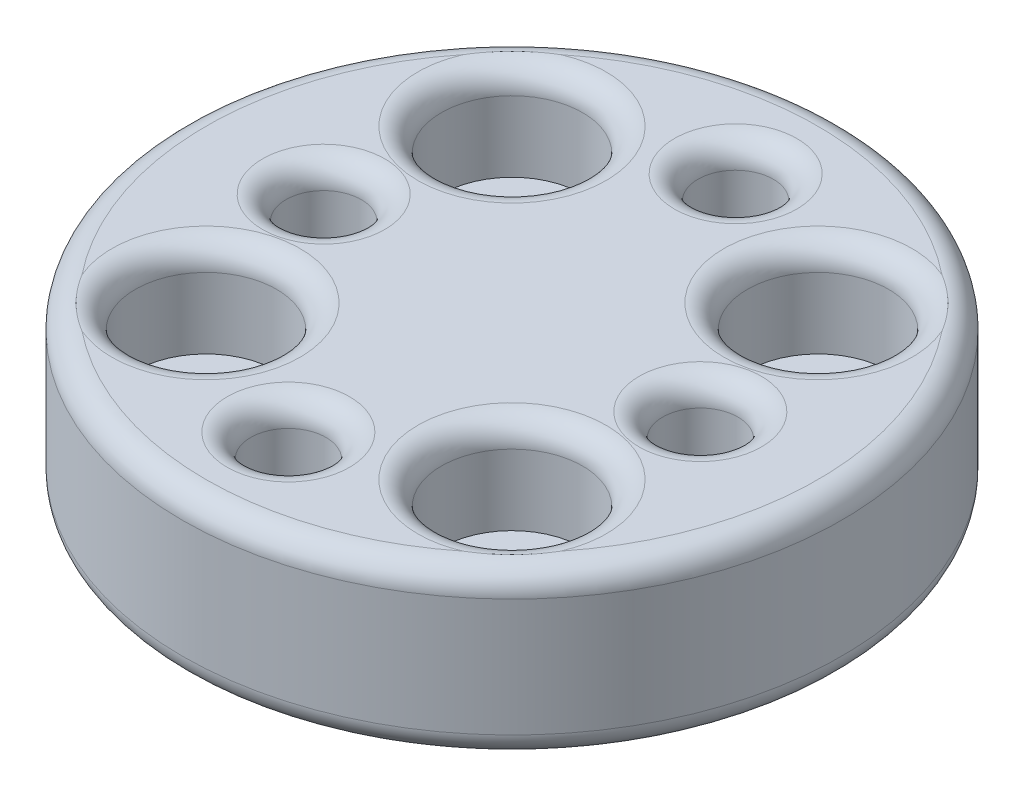
from build123d import *

# Parameters (mm, degrees)
SKETCH_1_R          = 14
SKETCH_1_R_2        = 1.6
EXTRUDE_1_DEPTH     = 7
SKETCH_2_R          = 3
CUT_EXTRUDE_1_DEPTH = 4
SKETCH_3_R          = 1.6
CUT_EXTRUDE_2_DEPTH = 22
FILLET_1_R          = 1


with BuildPart() as part:
    # 草图1 → 凸台-拉伸1 (new body)
    with BuildSketch(Plane(origin=(0, 0, 0), x_dir=(1, 0, 0), z_dir=(0, 1, 0))):
        with Locations(Location((0, 0, 0), (0, 0, 270))):
            Circle(SKETCH_1_R)
        with Locations(Location((0, 9.5, 0), (0, 0, 270))):
            Circle(SKETCH_1_R_2, mode=Mode.SUBTRACT)
        with Locations(Location((8, 0, 0), (0, 0, 270))):
            Circle(SKETCH_1_R_2, mode=Mode.SUBTRACT)
        with Locations(Location((-8, 0, 0), (0, 0, 270))):
            Circle(SKETCH_1_R_2, mode=Mode.SUBTRACT)
        with Locations(Location((0, -9.5, 0), (0, 0, 270))):
            Circle(SKETCH_1_R_2, mode=Mode.SUBTRACT)
    extrude(amount=EXTRUDE_1_DEPTH)

    # 草图2 → 切除-拉伸1 (cut)
    with BuildSketch(Plane(origin=(0, 7, 0), x_dir=(1, 0, 0), z_dir=(0, 1, 0))):
        with Locations(Location((6.5, 6.5, 0), (0, 0, 270))):
            Circle(SKETCH_2_R)
        with Locations(Location((6.5, -6.5, 0), (0, 0, 270))):
            Circle(SKETCH_2_R)
        with Locations(Location((-6.5, -6.5, 0), (0, 0, 270))):
            Circle(SKETCH_2_R)
        with Locations(Location((-6.5, 6.5, 0), (0, 0, 270))):
            Circle(SKETCH_2_R)
    extrude(amount=-CUT_EXTRUDE_1_DEPTH, mode=Mode.SUBTRACT)

    # 草图3 → 切除-拉伸2 (cut, through all)
    with BuildSketch(Plane(origin=(0, 7, 0), x_dir=(1, 0, 0), z_dir=(0, 1, 0))):
        with Locations(Location((-6.5, 6.5, 0), (0, 0, 270))):
            Circle(SKETCH_3_R)
        with Locations(Location((6.5, 6.5, 0), (0, 0, 270))):
            Circle(SKETCH_3_R)
        with Locations(Location((6.5, -6.5, 0), (0, 0, 270))):
            Circle(SKETCH_3_R)
        with Locations(Location((-6.5, -6.5, 0), (0, 0, 270))):
            Circle(SKETCH_3_R)
    extrude(amount=-CUT_EXTRUDE_2_DEPTH, mode=Mode.SUBTRACT)

    # 圆角1
    # the kernel refuses this fillet: 1 mm, written as the material it takes off along each edge
    with BuildSketch(Plane(origin=(-8, 0, 0), x_dir=(0, 0, 1), z_dir=(-1, 0, 0))) as fillet_1_piece_1:
        with BuildLine():
            CenterArc((1.6 + FILLET_1_R, FILLET_1_R), FILLET_1_R, 180, 90)
            Line((1.6, FILLET_1_R), (1.6, 0))
            Line((1.6, 0), (1.6 + FILLET_1_R, 0))
        make_face()
    revolve(axis=Axis((-8, 0, 0), (0, 1, 0)), mode=Mode.SUBTRACT)
    with BuildSketch(Plane(origin=(-8, 7, 0), x_dir=(0, 0, 1), z_dir=(-1, 0, 0))) as fillet_1_piece_2:
        with BuildLine():
            CenterArc((1.6 + FILLET_1_R, -FILLET_1_R), FILLET_1_R, 90, 90)
            Line((1.6, -FILLET_1_R), (1.6, 0))
            Line((1.6, 0), (1.6 + FILLET_1_R, 0))
        make_face()
    revolve(axis=Axis((-8, 7, 0), (0, 1, 0)), mode=Mode.SUBTRACT)
    with BuildSketch(Plane(origin=(0, 0, 9.5), x_dir=(0, 0, 1), z_dir=(-1, 0, 0))) as fillet_1_piece_3:
        with BuildLine():
            CenterArc((1.6 + FILLET_1_R, FILLET_1_R), FILLET_1_R, 180, 90)
            Line((1.6, FILLET_1_R), (1.6, 0))
            Line((1.6, 0), (1.6 + FILLET_1_R, 0))
        make_face()
    revolve(axis=Axis((0, 0, 9.5), (0, 1, 0)), mode=Mode.SUBTRACT)
    with BuildSketch(Plane(origin=(0, 7, 9.5), x_dir=(0, 0, 1), z_dir=(-1, 0, 0))) as fillet_1_piece_4:
        with BuildLine():
            CenterArc((1.6 + FILLET_1_R, -FILLET_1_R), FILLET_1_R, 90, 90)
            Line((1.6, -FILLET_1_R), (1.6, 0))
            Line((1.6, 0), (1.6 + FILLET_1_R, 0))
        make_face()
    revolve(axis=Axis((0, 7, 9.5), (0, 1, 0)), mode=Mode.SUBTRACT)
    with BuildSketch(Plane(origin=(0, 0, 0), x_dir=(0, 0, 1), z_dir=(-1, 0, 0))) as fillet_1_piece_5:
        with BuildLine():
            CenterArc((14 - FILLET_1_R, FILLET_1_R), FILLET_1_R, 270, 90)
            Line((14 - FILLET_1_R, 0), (14, 0))
            Line((14, 0), (14, FILLET_1_R))
        make_face()
    revolve(axis=Axis((0, 0, 0), (0, 1, 0)), mode=Mode.SUBTRACT)
    with BuildSketch(Plane(origin=(-6.5, 7, -6.5), x_dir=(0, 0, 1), z_dir=(-1, 0, 0))) as fillet_1_piece_6:
        with BuildLine():
            CenterArc((3 + FILLET_1_R, -FILLET_1_R), FILLET_1_R, 90, 90)
            Line((3, -FILLET_1_R), (3, 0))
            Line((3, 0), (3 + FILLET_1_R, 0))
        make_face()
    revolve(axis=Axis((-6.5, 7, -6.5), (0, 1, 0)), mode=Mode.SUBTRACT)
    with BuildSketch(Plane(origin=(-6.5, 7, 6.5), x_dir=(0, 0, 1), z_dir=(-1, 0, 0))) as fillet_1_piece_7:
        with BuildLine():
            CenterArc((3 + FILLET_1_R, -FILLET_1_R), FILLET_1_R, 90, 90)
            Line((3, -FILLET_1_R), (3, 0))
            Line((3, 0), (3 + FILLET_1_R, 0))
        make_face()
    revolve(axis=Axis((-6.5, 7, 6.5), (0, 1, 0)), mode=Mode.SUBTRACT)
    with BuildSketch(Plane(origin=(6.5, 7, 6.5), x_dir=(0, 0, 1), z_dir=(-1, 0, 0))) as fillet_1_piece_8:
        with BuildLine():
            CenterArc((3 + FILLET_1_R, -FILLET_1_R), FILLET_1_R, 90, 90)
            Line((3, -FILLET_1_R), (3, 0))
            Line((3, 0), (3 + FILLET_1_R, 0))
        make_face()
    revolve(axis=Axis((6.5, 7, 6.5), (0, 1, 0)), mode=Mode.SUBTRACT)
    with BuildSketch(Plane(origin=(6.5, 7, -6.5), x_dir=(0, 0, 1), z_dir=(-1, 0, 0))) as fillet_1_piece_9:
        with BuildLine():
            CenterArc((3 + FILLET_1_R, -FILLET_1_R), FILLET_1_R, 90, 90)
            Line((3, -FILLET_1_R), (3, 0))
            Line((3, 0), (3 + FILLET_1_R, 0))
        make_face()
    revolve(axis=Axis((6.5, 7, -6.5), (0, 1, 0)), mode=Mode.SUBTRACT)
    with BuildSketch(Plane(origin=(-6.5, 0, 6.5), x_dir=(0, 0, 1), z_dir=(-1, 0, 0))) as fillet_1_piece_10:
        with BuildLine():
            CenterArc((1.6 + FILLET_1_R, FILLET_1_R), FILLET_1_R, 180, 90)
            Line((1.6, FILLET_1_R), (1.6, 0))
            Line((1.6, 0), (1.6 + FILLET_1_R, 0))
        make_face()
    revolve(axis=Axis((-6.5, 0, 6.5), (0, 1, 0)), mode=Mode.SUBTRACT)
    with BuildSketch(Plane(origin=(6.5, 0, 6.5), x_dir=(0, 0, 1), z_dir=(-1, 0, 0))) as fillet_1_piece_11:
        with BuildLine():
            CenterArc((1.6 + FILLET_1_R, FILLET_1_R), FILLET_1_R, 180, 90)
            Line((1.6, FILLET_1_R), (1.6, 0))
            Line((1.6, 0), (1.6 + FILLET_1_R, 0))
        make_face()
    revolve(axis=Axis((6.5, 0, 6.5), (0, 1, 0)), mode=Mode.SUBTRACT)
    with BuildSketch(Plane(origin=(6.5, 0, -6.5), x_dir=(0, 0, 1), z_dir=(-1, 0, 0))) as fillet_1_piece_12:
        with BuildLine():
            CenterArc((1.6 + FILLET_1_R, FILLET_1_R), FILLET_1_R, 180, 90)
            Line((1.6, FILLET_1_R), (1.6, 0))
            Line((1.6, 0), (1.6 + FILLET_1_R, 0))
        make_face()
    revolve(axis=Axis((6.5, 0, -6.5), (0, 1, 0)), mode=Mode.SUBTRACT)
    with BuildSketch(Plane(origin=(0, 7, 0), x_dir=(0, 0, 1), z_dir=(-1, 0, 0))) as fillet_1_piece_13:
        with BuildLine():
            CenterArc((14 - FILLET_1_R, -FILLET_1_R), FILLET_1_R, 0, 90)
            Line((14 - FILLET_1_R, 0), (14, 0))
            Line((14, 0), (14, -FILLET_1_R))
        make_face()
    revolve(axis=Axis((0, 7, 0), (0, 1, 0)), mode=Mode.SUBTRACT)
    with BuildSketch(Plane(origin=(-6.5, 0, -6.5), x_dir=(0, 0, 1), z_dir=(-1, 0, 0))) as fillet_1_piece_14:
        with BuildLine():
            CenterArc((1.6 + FILLET_1_R, FILLET_1_R), FILLET_1_R, 180, 90)
            Line((1.6, FILLET_1_R), (1.6, 0))
            Line((1.6, 0), (1.6 + FILLET_1_R, 0))
        make_face()
    revolve(axis=Axis((-6.5, 0, -6.5), (0, 1, 0)), mode=Mode.SUBTRACT)
    with BuildSketch(Plane(origin=(0, 0, -9.5), x_dir=(0, 0, 1), z_dir=(-1, 0, 0))) as fillet_1_piece_15:
        with BuildLine():
            CenterArc((1.6 + FILLET_1_R, FILLET_1_R), FILLET_1_R, 180, 90)
            Line((1.6, FILLET_1_R), (1.6, 0))
            Line((1.6, 0), (1.6 + FILLET_1_R, 0))
        make_face()
    revolve(axis=Axis((0, 0, -9.5), (0, 1, 0)), mode=Mode.SUBTRACT)
    with BuildSketch(Plane(origin=(0, 7, -9.5), x_dir=(0, 0, 1), z_dir=(-1, 0, 0))) as fillet_1_piece_16:
        with BuildLine():
            CenterArc((1.6 + FILLET_1_R, -FILLET_1_R), FILLET_1_R, 90, 90)
            Line((1.6, -FILLET_1_R), (1.6, 0))
            Line((1.6, 0), (1.6 + FILLET_1_R, 0))
        make_face()
    revolve(axis=Axis((0, 7, -9.5), (0, 1, 0)), mode=Mode.SUBTRACT)
    with BuildSketch(Plane(origin=(8, 0, 0), x_dir=(0, 0, 1), z_dir=(-1, 0, 0))) as fillet_1_piece_17:
        with BuildLine():
            CenterArc((1.6 + FILLET_1_R, FILLET_1_R), FILLET_1_R, 180, 90)
            Line((1.6, FILLET_1_R), (1.6, 0))
            Line((1.6, 0), (1.6 + FILLET_1_R, 0))
        make_face()
    revolve(axis=Axis((8, 0, 0), (0, 1, 0)), mode=Mode.SUBTRACT)
    with BuildSketch(Plane(origin=(8, 7, 0), x_dir=(0, 0, 1), z_dir=(-1, 0, 0))) as fillet_1_piece_18:
        with BuildLine():
            CenterArc((1.6 + FILLET_1_R, -FILLET_1_R), FILLET_1_R, 90, 90)
            Line((1.6, -FILLET_1_R), (1.6, 0))
            Line((1.6, 0), (1.6 + FILLET_1_R, 0))
        make_face()
    revolve(axis=Axis((8, 7, 0), (0, 1, 0)), mode=Mode.SUBTRACT)


solid = part.part
